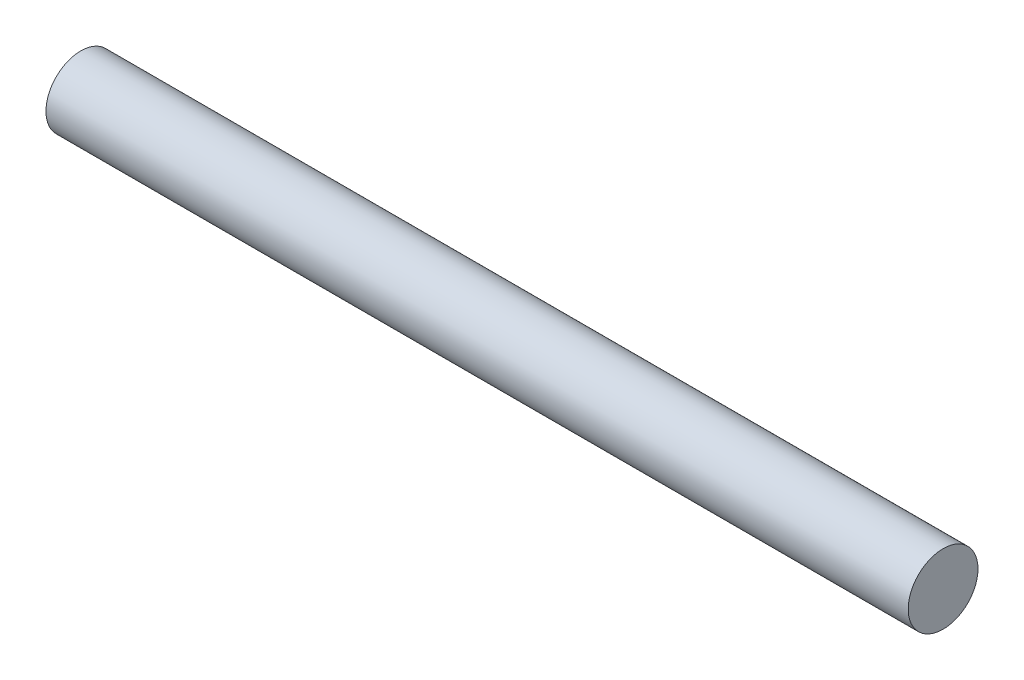
from build123d import *

# Parameters (mm, degrees)
SKETCH1_R           = 21.59
BOSS_EXTRUDE1_DEPTH = 533.4


with BuildPart() as part:
    # Sketch1 → Boss-Extrude1 (new body)
    with BuildSketch(Plane(origin=(0, 0, 0), x_dir=(0, 0, -1), z_dir=(1, 0, 0))):
        Circle(SKETCH1_R)
    extrude(amount=BOSS_EXTRUDE1_DEPTH)


solid = part.part
